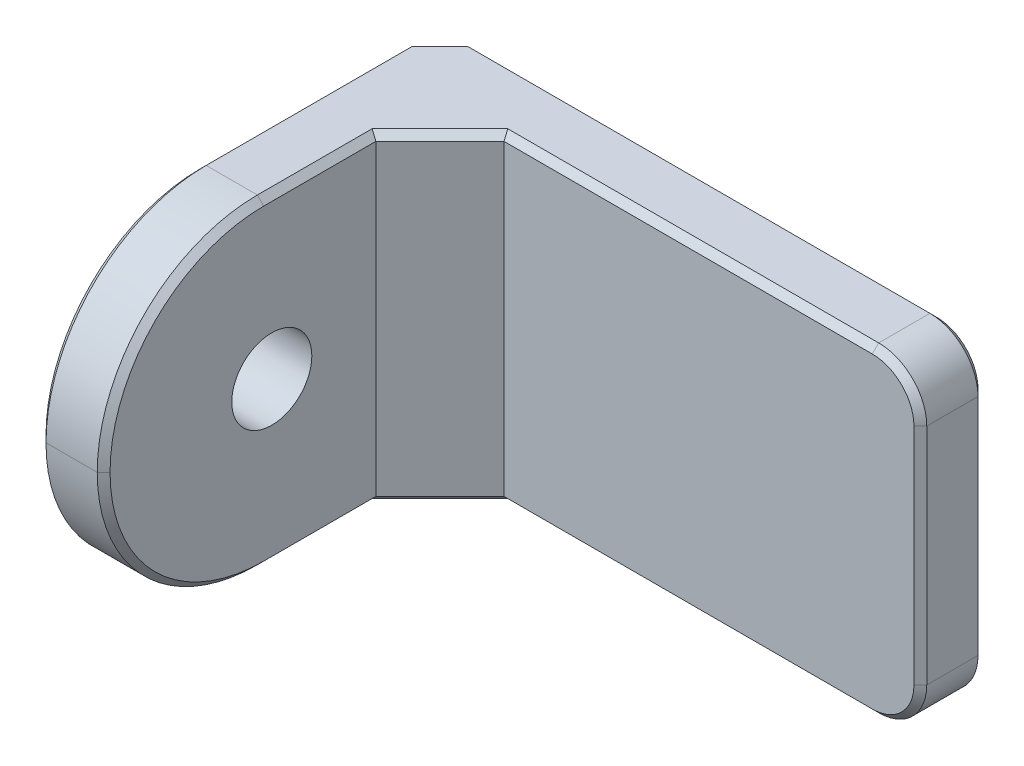
from build123d import *

# Parameters (mm, degrees)
EXTRUDE_1_DEPTH     = 20
SKETCH_2_R          = 2.5
CUT_EXTRUDE_1_DEPTH = 20
FILLET_1_R          = 10
CHAMFER_1_SIZE      = 4
CHAMFER_2_SIZE      = 2
FILLET_2_R          = 3
CHAMFER_3_SIZE      = 0.4


with BuildPart() as part:
    # 草图1 → 凸台-拉伸1 (new body)
    with BuildSketch(Plane(origin=(0, 0, 0), x_dir=(1, 0, 0), z_dir=(0, 1, 0))):
        Polygon((0, 0), (4, 0), (4, 21), (34, 21), (34, 25), (4, 25), (0, 25), align=None)
    extrude(amount=EXTRUDE_1_DEPTH)

    # 草图2 → 切除-拉伸1 (cut)
    with BuildSketch(Plane(origin=(4, 0, 0), x_dir=(0, 0, -1), z_dir=(1, 0, 0))):
        with Locations((10.5, 10)):
            Circle(SKETCH_2_R)
    extrude(amount=-CUT_EXTRUDE_1_DEPTH, mode=Mode.SUBTRACT)

    # 圆角1
    fillet_1_edges = [part.edges().sort_by_distance(p)[0] for p in [
        (2, 0, 0),
        (2, 20, 0),
    ]]
    fillet(fillet_1_edges, radius=FILLET_1_R - 0.0001)  # a hair under: the kernel refuses the full size

    # 倒角1
    chamfer_1_edges = [part.edges().sort_by_distance(p)[0] for p in [
        (4, 10, -21),
    ]]
    chamfer(chamfer_1_edges, length=CHAMFER_1_SIZE)

    # 倒角2
    chamfer_2_edges = [part.edges().sort_by_distance(p)[0] for p in [
        (0, 10, -25),
    ]]
    chamfer(chamfer_2_edges, length=CHAMFER_2_SIZE)

    # 圆角2
    fillet_2_edges = [part.edges().sort_by_distance(p)[0] for p in [
        (34, 20, -23),
        (34, 0, -23),
    ]]
    fillet(fillet_2_edges, radius=FILLET_2_R)

    # 倒角3
    chamfer_3_edges = [part.edges().sort_by_distance(p)[0] for p in [
        (4, 0, -13.49995),
        (4, 20, -13.49995),
        (4, 17.071097101, -2.928902899),
        (4, 2.928902899, -2.928902899),
        (0, 17.071097101, -2.928902899),
        (0, 2.928902899, -2.928902899),
        (19.5, 0, -21),
        (19.5, 20, -21),
        (6, 0, -19),
        (6, 20, -19),
        (0, 0, -16.49995),
        (0, 20, -16.49995),
        (1, 0, -24),
        (1, 20, -24),
        (34, 10, -25),
        (34, 10, -21),
        (16.5, 0, -25),
        (16.5, 20, -25),
        (33.121320344, 19.121320344, -25),
        (33.121320344, 0.878679656, -25),
        (33.121320344, 19.121320344, -21),
        (33.121320344, 0.878679656, -21),
    ]]
    chamfer(chamfer_3_edges, length=CHAMFER_3_SIZE)


solid = part.part
